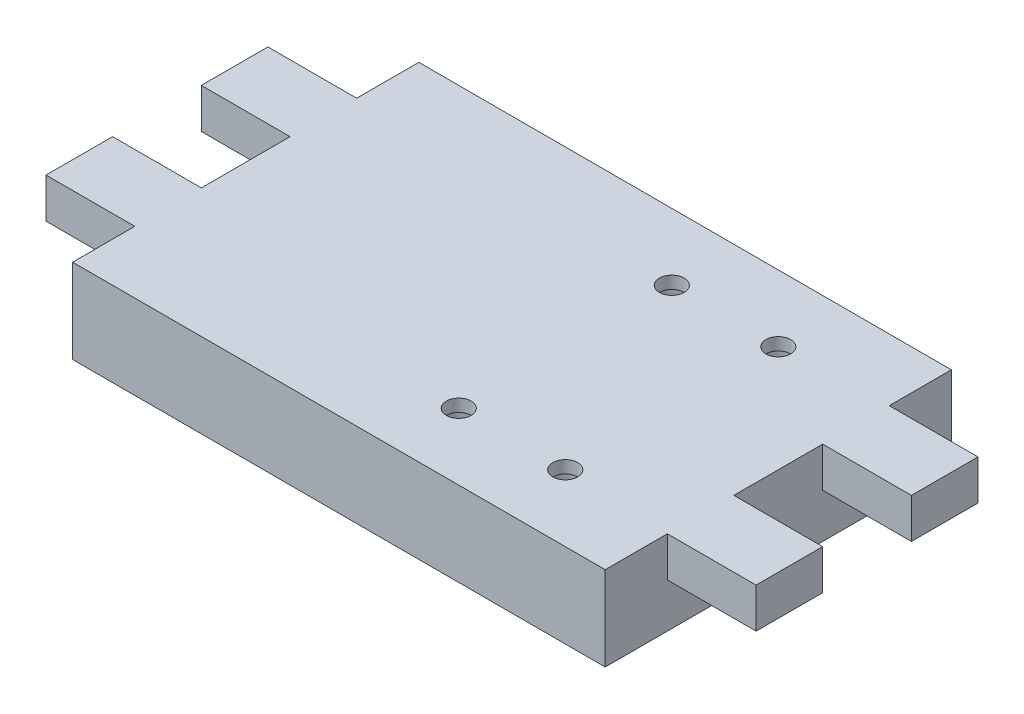
from build123d import *

# Parameters (mm, degrees)
SKETCH1_W                       = 25
SKETCH1_H                       = 4.5
BOSS_EXTRUDE1_DEPTH             = 30
SKETCH2_W                       = 7.5
SKETCH2_H                       = 4.5
BOSS_EXTRUDE2_DEPTH             = 10
ESQUISSE1_W                     = 60
ESQUISSE1_H                     = 4.5
BOSS_EXTRU_1_DEPTH              = 7
SKETCH6_W                       = 60
SKETCH6_H                       = 39
BOSS_EXTRUDE3_DEPTH             = 5
CBORE_FOR_M3_SBHCS2_D           = 2.8
CBORE_FOR_M3_SBHCS2_CBORE_D     = 5.5
CBORE_FOR_M3_SBHCS2_CBORE_DEPTH = 8.1


with BuildPart() as part:
    # Sketch1 → Boss-Extrude1 (new, symmetric)
    with BuildSketch(Plane(origin=(0, 0, 0), x_dir=(0, 0, -1), z_dir=(1, 0, 0))):
        Rectangle(SKETCH1_W, SKETCH1_H)
    extrude(amount=BOSS_EXTRUDE1_DEPTH, both=True)

    # Sketch2 → Boss-Extrude2 (add)
    with BuildSketch(Plane(origin=(30, 0, 0), x_dir=(0, 0, -1), z_dir=(1, 0, 0))):
        with Locations((-8.75, 0)):
            Rectangle(SKETCH2_W, SKETCH2_H)
        with Locations((8.75, 0)):
            Rectangle(SKETCH2_W, SKETCH2_H)
    boss_extrude2 = extrude(amount=BOSS_EXTRUDE2_DEPTH)

    # Esquisse1 → Boss.-Extru.1 (add)
    with BuildSketch(Plane.XY.offset(12.5)):
        Rectangle(ESQUISSE1_W, ESQUISSE1_H)
    boss_extru_1 = extrude(amount=BOSS_EXTRU_1_DEPTH)

    # Symétrie1: Boss.-Extru.1 across plane
    add(boss_extru_1.mirror(Plane.XY))

    # Mirror1: Boss-Extrude2 across plane
    add(boss_extrude2.mirror(Plane(origin=(0, 0, 0), x_dir=(0, 0, 1), z_dir=(1, 0, 0))))

    # Sketch6 → Boss-Extrude3 (add)
    with BuildSketch(Plane.XZ.offset(2.25)):
        Rectangle(SKETCH6_W, SKETCH6_H)
    extrude(amount=BOSS_EXTRUDE3_DEPTH)

    # CBORE for M3 SBHCS2 (through all)
    with Locations(Plane(origin=(0, -7.25, 0), x_dir=(-1, 0, 0), z_dir=(0, -1, 0))):
        with Locations((-18, 12), (-6, 12), (-6, -12), (-18, -12)):
            CounterBoreHole(CBORE_FOR_M3_SBHCS2_D / 2, CBORE_FOR_M3_SBHCS2_CBORE_D / 2, CBORE_FOR_M3_SBHCS2_CBORE_DEPTH)


solid = part.part
